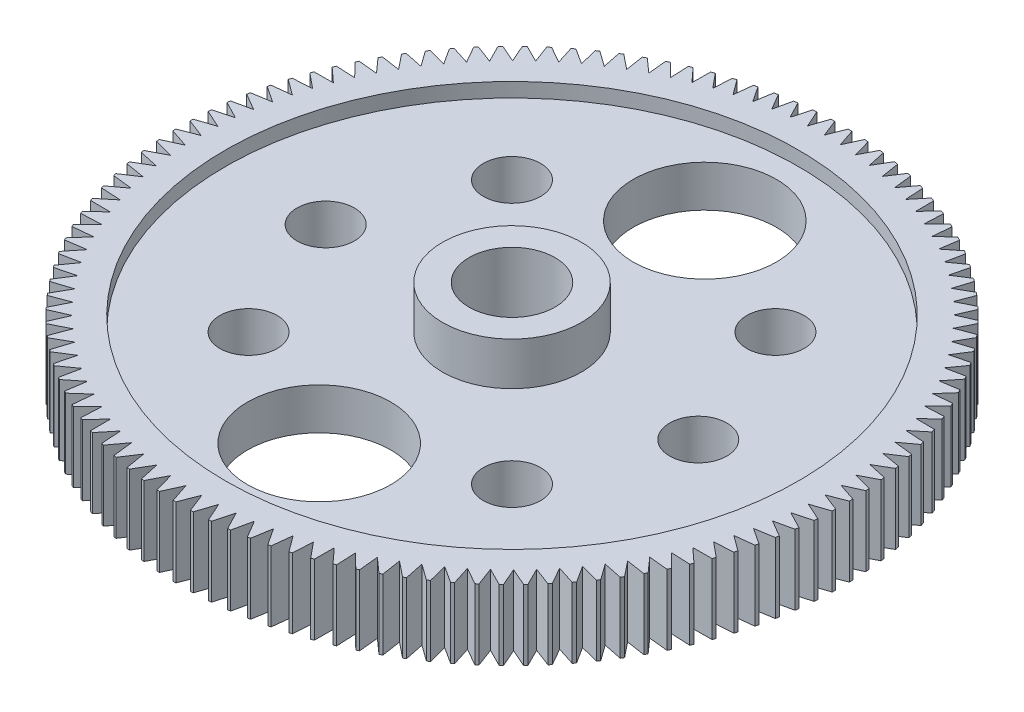
from build123d import *

# Parameters (mm, degrees)
SKETCH_1_R          = 23
EXTRUDE_1_DEPTH     = 4.9
CUT_EXTRUDE_2_DEPTH = 4.9
SKETCH_3_R          = 20
CUT_EXTRUDE_3_DEPTH = 1
CUT_EXTRUDE_START   = -1
SKETCH_4_R          = 20
CUT_EXTRUDE_4_DEPTH = 1
SKETCH_5_R          = 3
CUT_EXTRUDE_5_DEPTH = 33.754146738
EXTRUDE_START       = 3
SKETCH_6_R          = 4.85
SKETCH_6_R_2        = 3
EXTRUDE_6_DEPTH     = 3
SKETCH_7_R          = 4.85
SKETCH_7_R_2        = 3
EXTRUDE_7_DEPTH     = 3
SKETCH_8_R          = 5
SKETCH_8_R_2        = 2
CUT_EXTRUDE_8_DEPTH = 34.051991294


with BuildPart() as part:
    # Эскиз1 → Вытянуть1 (new body)
    with BuildSketch(Plane(origin=(0, 0, 0), x_dir=(1, 0, 0), z_dir=(0, 1, 0))):
        Circle(SKETCH_1_R)
    extrude(amount=EXTRUDE_1_DEPTH)

    # Эскиз2 → Вытянуть2 (cut)
    with BuildSketch(Plane(origin=(0, 4.9, 0), x_dir=(1, 0, 0), z_dir=(0, 1, 0))):
        Polygon((-0.546509718, 23.19744622), (0.546509718, 23.19744622), (0, 21.800547108), align=None)
        Polygon((0.665520964, 23.195560684), (1.757042456, 23.138356466), (1.13817366, 21.771973865), align=None)
        Polygon((1.87579192, 23.130244947), (2.962823682, 23.015993305), (2.273292084, 21.683872374), align=None)
        Polygon((3.08098588, 23.001678035), (4.160548434, 22.830692124), (3.402243992, 21.536484114), align=None)
        Polygon((4.277799491, 22.810212342), (5.346933831, 22.582960822), (4.521935005, 21.330213068), align=None)
        Polygon((5.46295237, 22.556372661), (6.518728073, 22.273478414), (5.629296128, 21.065624609), align=None)
        Polygon((6.633196097, 22.240854749), (7.672719354, 21.903093167), (6.721292161, 20.743443955), align=None)
        Polygon((7.785323113, 21.864523418), (8.805744665, 21.472820284), (7.794930018, 20.364554183), align=None)
        Polygon((8.916175519, 21.428410168), (9.914698461, 20.983839112), (8.847266934, 19.929993802), align=None)
        Polygon((10.022653727, 20.933710354), (10.996541176, 20.437489914), (9.875418526, 19.440953912), align=None)
        Polygon((11.101724958, 20.381779914), (12.048307557, 19.835270195), (10.876566701, 18.898774937), align=None)
        Polygon((12.150431551, 19.77413165), (13.067114783, 19.178830599), (11.847967383, 18.304942953), align=None)
        Polygon((13.165899076, 19.112431085), (14.050170375, 18.469970379), (12.786958029, 17.661085612), align=None)
        Polygon((14.145344206, 18.398491894), (14.994779847, 17.710632474), (13.690964931, 16.968967681), align=None)
        Polygon((15.08608235, 17.634270933), (15.898354088, 16.902898175), (14.557510269, 16.230486208), align=None)
        Polygon((15.98553501, 16.821862881), (16.758416466, 16.048981426), (15.384218903, 15.447665319), align=None)
        Polygon((16.841236849, 15.963494491), (17.572609608, 15.151222752), (16.168824882, 14.622650672), align=None)
        Polygon((17.650842449, 15.061518491), (18.338701868, 14.21208285), (16.909177655, 13.757703575), align=None)
        Polygon((18.412132735, 14.118407134), (19.054593441, 13.234135835), (17.603247967, 12.855194788), align=None)
        Polygon((19.123021065, 13.136745424), (19.718322117, 12.220062192), (18.24913342, 11.917598024), align=None)
        Polygon((19.781558943, 12.119224026), (20.328068662, 11.172641427), (18.845063685, 10.947483171), align=None)
        Polygon((20.385941363, 11.068631897), (20.882161803, 10.094744447), (19.389405361, 9.947509246), align=None)
        Polygon((20.934511753, 9.987848635), (21.37908281, 8.989325693), (19.880666443, 8.920417109), align=None)
        Polygon((21.425766521, 8.879836594), (21.817469656, 7.859415042), (20.31750042, 7.869021947), align=None)
        Polygon((21.858359172, 7.747632756), (22.196120754, 6.708109498), (20.69870996, 6.796205562), align=None)
        Polygon((22.231104, 6.594340415), (22.513998247, 5.538564712), (21.023250195, 5.704908469), align=None)
        Polygon((22.542979336, 5.423120663), (22.770230855, 4.353986323), (21.290231581, 4.598121837), align=None)
        Polygon((22.793130352, 4.237183734), (22.964116263, 3.15762118), (21.498922342, 3.478879291), align=None)
        Polygon((22.980871401, 3.039780197), (23.095123043, 1.952748435), (21.64875047, 2.350248598), align=None)
        Polygon((23.105687899, 1.834192053), (23.162892116, 0.742670561), (21.739305298, 1.215323256), align=None)
        Polygon((23.167237732, 0.623723734), (23.167237732, -0.469295702), (21.77033862, 0.077214016), align=None)
        Polygon((23.165352196, -0.588306948), (23.108147978, -1.67982844), (21.741765377, -1.060959644), align=None)
        Polygon((23.100036459, -1.798577904), (22.985784817, -2.885609666), (21.653663886, -2.196078068), align=None)
        Polygon((22.971469547, -3.003771864), (22.800483636, -4.083334418), (21.506275626, -3.325029976), align=None)
        Polygon((22.780003854, -4.200585475), (22.552752334, -5.269719815), (21.30000458, -4.444720989), align=None)
        Polygon((22.526164172, -5.385738354), (22.243269926, -6.441514057), (21.03541612, -5.552082112), align=None)
        Polygon((22.21064626, -6.555982081), (21.872884679, -7.595505338), (20.713235467, -6.644078145), align=None)
        Polygon((21.83431493, -7.708109097), (21.442611796, -8.728530649), (20.334345695, -7.717716002), align=None)
        Polygon((21.39820168, -8.838961503), (20.953630624, -9.837484445), (19.899785314, -8.770052918), align=None)
        Polygon((20.903501866, -9.945439711), (20.407281426, -10.91932716), (19.410745424, -9.79820451), align=None)
        Polygon((20.351571426, -11.024510942), (19.805061707, -11.971093541), (18.868566449, -10.799352685), align=None)
        Polygon((19.743923162, -12.073217535), (19.148622111, -12.989900767), (18.274734465, -11.770753367), align=None)
        Polygon((19.082222597, -13.08868506), (18.439761891, -13.972956359), (17.630877124, -12.709744013), align=None)
        Polygon((18.368283405, -14.06813019), (17.680423986, -14.917565831), (16.938759193, -13.613750915), align=None)
        Polygon((17.604062445, -15.008868334), (16.872689687, -15.821140072), (16.20027772, -14.480296253), align=None)
        Polygon((16.791654393, -15.908320994), (16.018772937, -16.68120245), (15.417456831, -15.307004888), align=None)
        Polygon((15.933286003, -16.764022833), (15.121014264, -17.495395592), (14.592442184, -16.091610866), align=None)
        Polygon((15.031310003, -17.573628433), (14.181874362, -18.261487852), (13.727495087, -16.83196364), align=None)
        Polygon((14.088198646, -18.334918719), (13.203927347, -18.977379425), (12.8249863, -17.526033952), align=None)
        Polygon((13.106536936, -19.045807049), (12.189853704, -19.641108101), (11.887389536, -18.171919404), align=None)
        Polygon((12.089015538, -19.704344927), (11.142432939, -20.250854646), (10.917274683, -18.767849669), align=None)
        Polygon((11.038423408, -20.308727347), (10.064535959, -20.804947787), (9.917300758, -19.312191345), align=None)
        Polygon((9.957640147, -20.857297737), (8.959117205, -21.301868794), (8.890208621, -19.803452427), align=None)
        Polygon((8.849628106, -21.348552505), (7.829206554, -21.74025564), (7.838813459, -20.240286404), align=None)
        Polygon((7.717424268, -21.781145156), (6.67790101, -22.118906738), (6.765997074, -20.621495944), align=None)
        Polygon((6.564131926, -22.153889984), (5.508356224, -22.436784231), (5.674699981, -20.946036179), align=None)
        Polygon((5.392912175, -22.46576532), (4.323777835, -22.693016839), (4.567913349, -21.213017565), align=None)
        Polygon((4.206975246, -22.715916336), (3.127412692, -22.886902247), (3.448670803, -21.421708326), align=None)
        Polygon((3.009571709, -22.903657385), (1.922539947, -23.017909027), (2.32004011, -21.571536454), align=None)
        Polygon((1.803983565, -23.028473883), (0.712462073, -23.0856781), (1.185114768, -21.662091282), align=None)
        Polygon((0.593515246, -23.090023716), (-0.499504191, -23.090023716), (0.047005528, -21.693124604), align=None)
        Polygon((-0.618515437, -23.08813818), (-1.710036928, -23.030933962), (-1.091168132, -21.664551361), align=None)
        Polygon((-1.828786392, -23.022822443), (-2.915818154, -22.908570801), (-2.226286556, -21.57644987), align=None)
        Polygon((-3.033980352, -22.894255531), (-4.113542906, -22.72326962), (-3.355238464, -21.42906161), align=None)
        Polygon((-4.230793963, -22.702789838), (-5.299928303, -22.475538318), (-4.474929477, -21.222790564), align=None)
        Polygon((-5.415946842, -22.448950156), (-6.471722545, -22.16605591), (-5.5822906, -20.958202105), align=None)
        Polygon((-6.586190569, -22.133432245), (-7.625713827, -21.795670663), (-6.674286633, -20.636021451), align=None)
        Polygon((-7.738317585, -21.757100914), (-8.758739137, -21.36539778), (-7.747924491, -20.257131679), align=None)
        Polygon((-8.869169991, -21.320987664), (-9.867692933, -20.876416608), (-8.800261406, -19.822571298), align=None)
        Polygon((-9.975648199, -20.82628785), (-10.949535649, -20.33006741), (-9.828412998, -19.333531408), align=None)
        Polygon((-11.05471943, -20.27435741), (-12.001302029, -19.727847691), (-10.829561174, -18.791352433), align=None)
        Polygon((-12.103426023, -19.666709146), (-13.020109255, -19.071408095), (-11.800961855, -18.197520449), align=None)
        Polygon((-13.118893548, -19.005008581), (-14.003164847, -18.362547875), (-12.739952501, -17.553663108), align=None)
        Polygon((-14.098338678, -18.29106939), (-14.947774319, -17.60320997), (-13.643959403, -16.861545177), align=None)
        Polygon((-15.039076822, -17.526848429), (-15.85134856, -16.795475671), (-14.510504741, -16.123063704), align=None)
        Polygon((-15.938529482, -16.714440377), (-16.711410938, -15.941558922), (-15.337213376, -15.340242815), align=None)
        Polygon((-16.794231322, -15.856071987), (-17.52560408, -15.043800248), (-16.121819354, -14.515228168), align=None)
        Polygon((-17.603836921, -14.954095987), (-18.29169634, -14.104660346), (-16.862172128, -13.650281071), align=None)
        Polygon((-18.365127207, -14.01098463), (-19.007587913, -13.126713331), (-17.55624244, -12.747772284), align=None)
        Polygon((-19.076015537, -13.02932292), (-19.671316589, -12.112639688), (-18.202127892, -11.81017552), align=None)
        Polygon((-19.734553415, -12.011801522), (-20.281063134, -11.065218923), (-18.798058157, -10.840060667), align=None)
        Polygon((-20.338935835, -10.961209393), (-20.835156275, -9.987321943), (-19.342399833, -9.840086742), align=None)
        Polygon((-20.887506225, -9.880426131), (-21.332077282, -8.881903189), (-19.833660915, -8.812994605), align=None)
        Polygon((-21.378760993, -8.77241409), (-21.770464128, -7.751992538), (-20.270494892, -7.761599443), align=None)
        Polygon((-21.811353644, -7.640210252), (-22.149115226, -6.600686994), (-20.651704432, -6.688783058), align=None)
        Polygon((-22.184098472, -6.48691791), (-22.466992719, -5.431142208), (-20.976244667, -5.597485965), align=None)
        Polygon((-22.495973808, -5.315698159), (-22.723225327, -4.246563819), (-21.243226053, -4.490699333), align=None)
        Polygon((-22.746124824, -4.12976123), (-22.917110735, -3.050198676), (-21.451916814, -3.371456787), align=None)
        Polygon((-22.933865873, -2.932357693), (-23.048117515, -1.845325931), (-21.601744942, -2.242826094), align=None)
        Polygon((-23.058682371, -1.726769549), (-23.115886588, -0.635248057), (-21.69229977, -1.107900752), align=None)
        Polygon((-23.120232204, -0.51630123), (-23.120232204, 0.576718207), (-21.723333092, 0.030208488), align=None)
        Polygon((-23.118346668, 0.695729452), (-23.06114245, 1.787250944), (-21.694759849, 1.168382148), align=None)
        Polygon((-23.053030931, 1.906000408), (-22.938779289, 2.99303217), (-21.606658358, 2.303500572), align=None)
        Polygon((-22.924464019, 3.111194368), (-22.753478108, 4.190756922), (-21.459270098, 3.43245248), align=None)
        Polygon((-22.732998326, 4.308007979), (-22.505746807, 5.377142319), (-21.252999052, 4.552143493), align=None)
        Polygon((-22.479158645, 5.493160858), (-22.196264398, 6.548936561), (-20.988410593, 5.659504616), align=None)
        Polygon((-22.163640733, 6.663404585), (-21.825879151, 7.702927842), (-20.666229939, 6.751500649), align=None)
        Polygon((-21.787309402, 7.815531601), (-21.395606268, 8.835953153), (-20.287340167, 7.825138507), align=None)
        Polygon((-21.351196152, 8.946384007), (-20.906625096, 9.944906949), (-19.852779786, 8.877475422), align=None)
        Polygon((-20.856496338, 10.052862215), (-20.360275898, 11.026749664), (-19.363739896, 9.905627014), align=None)
        Polygon((-20.304565898, 11.131933446), (-19.758056179, 12.078516045), (-18.821560921, 10.906775189), align=None)
        Polygon((-19.696917634, 12.180640039), (-19.101616583, 13.097323271), (-18.227728937, 11.878175871), align=None)
        Polygon((-19.035217069, 13.196107564), (-18.392756364, 14.080378863), (-17.583871596, 12.817166517), align=None)
        Polygon((-18.321277878, 14.175552694), (-17.633418458, 15.024988335), (-16.891753665, 13.721173419), align=None)
        Polygon((-17.557056918, 15.116290838), (-16.825684159, 15.928562576), (-16.153272192, 14.587718757), align=None)
        Polygon((-16.744648865, 16.015743498), (-15.97176741, 16.788624954), (-15.370451303, 15.414427392), align=None)
        Polygon((-15.886280475, 16.871445338), (-15.074008736, 17.602818096), (-14.545436656, 16.19903337), align=None)
        Polygon((-14.984304475, 17.681050937), (-14.134868834, 18.368910356), (-13.680489559, 16.939386144), align=None)
        Polygon((-14.041193118, 18.442341223), (-13.156921819, 19.084801929), (-12.777980772, 17.633456456), align=None)
        Polygon((-13.059531408, 19.153229553), (-12.142848176, 19.748530605), (-11.840384008, 18.279341908), align=None)
        Polygon((-12.04201001, 19.811767431), (-11.095427411, 20.35827715), (-10.870269155, 18.875272173), align=None)
        Polygon((-10.991417881, 20.416149851), (-10.017530431, 20.912370291), (-9.87029523, 19.419613849), align=None)
        Polygon((-9.910634619, 20.964720241), (-8.912111677, 21.409291298), (-8.843203093, 19.910874931), align=None)
        Polygon((-8.802622578, 21.455975009), (-7.782201026, 21.847678144), (-7.791807931, 20.347708908), align=None)
        Polygon((-7.67041874, 21.88856766), (-6.630895482, 22.226329242), (-6.718991546, 20.728918448), align=None)
        Polygon((-6.517126399, 22.261312488), (-5.461350696, 22.544206735), (-5.627694453, 21.053458683), align=None)
        Polygon((-5.345906647, 22.573187824), (-4.276772307, 22.800439343), (-4.520907821, 21.320440069), align=None)
        Polygon((-4.159969718, 22.82333884), (-3.080407164, 22.994324751), (-3.401665275, 21.52913083), align=None)
        Polygon((-2.962566181, 23.011079889), (-1.875534419, 23.125331531), (-2.273034582, 21.678958958), align=None)
        Polygon((-1.756978037, 23.135896387), (-0.665456545, 23.193100604), (-1.13810924, 21.769513786), align=None)
    extrude(amount=-CUT_EXTRUDE_2_DEPTH, mode=Mode.SUBTRACT)

    # Эскиз3 → Вытянуть3 (cut)
    with BuildSketch(Plane(origin=(0, 4.9, 0), x_dir=(1, 0, 0), z_dir=(0, 1, 0))):
        Circle(SKETCH_3_R)
    extrude(amount=-CUT_EXTRUDE_3_DEPTH, mode=Mode.SUBTRACT)

    # Эскиз4 → Вытянуть4 (cut)
    with BuildSketch(Plane.XZ.offset(CUT_EXTRUDE_START)):
        Circle(SKETCH_4_R)
    extrude(amount=CUT_EXTRUDE_4_DEPTH, mode=Mode.SUBTRACT)

    # Эскиз5 → Вытянуть5 (cut, through all)
    with BuildSketch(Plane(origin=(0, 3.9, 0), x_dir=(1, 0, 0), z_dir=(0, 1, 0))):
        Circle(SKETCH_5_R)
    extrude(amount=-CUT_EXTRUDE_5_DEPTH, mode=Mode.SUBTRACT)

    # Эскиз6 → Вытянуть6 (add)
    with BuildSketch(Plane(origin=(0, 3.9, 0), x_dir=(1, 0, 0), z_dir=(0, 1, 0)).offset(EXTRUDE_START)):
        Circle(SKETCH_6_R)
        Circle(SKETCH_6_R_2, mode=Mode.SUBTRACT)
    extrude(amount=-EXTRUDE_6_DEPTH)

    # Эскиз7 → Вытянуть7 (add)
    with BuildSketch(Plane.XZ.offset(-1)):
        Circle(SKETCH_7_R)
        Circle(SKETCH_7_R_2, mode=Mode.SUBTRACT)
    extrude(amount=EXTRUDE_7_DEPTH)

    # Эскиз8 → Вытянуть8 (cut, through all)
    with BuildSketch(Plane.XZ.offset(-1)):
        with Locations((0, 13.457413349)):
            Circle(SKETCH_8_R)
        with Locations((0, -13.457413349)):
            Circle(SKETCH_8_R)
        with Locations((-13, 0)):
            Circle(SKETCH_8_R_2)
        with Locations((13, 0)):
            Circle(SKETCH_8_R_2)
        with Locations((-9.192388155, 9.192388155)):
            Circle(SKETCH_8_R_2)
        with Locations((9.192388155, -9.192388155)):
            Circle(SKETCH_8_R_2)
        with Locations((9.192388155, 9.192388155)):
            Circle(SKETCH_8_R_2)
        with Locations((-9.192388155, -9.192388155)):
            Circle(SKETCH_8_R_2)
    extrude(amount=-CUT_EXTRUDE_8_DEPTH, mode=Mode.SUBTRACT)


solid = part.part
